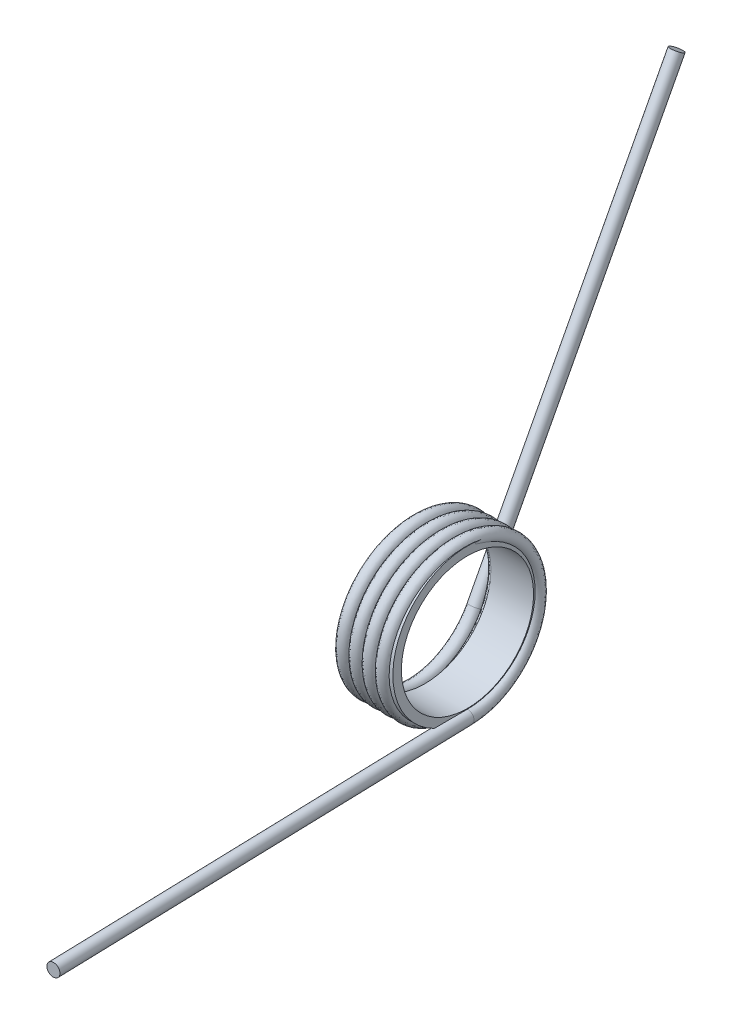
from build123d import *

# Parameters (mm, degrees)
SWEEP1_PITCH        = 0.7874
SKETCH4_R           = 0.381
EXTRUDE1_DEPTH      = 25.4
SKETCH5_R           = 0.381
EXTRUDE2_DEPTH      = 25.4
SKETCH7_R           = 4.445
SKETCH7_R_2         = 3.937
BOSS_EXTRUDE1_DEPTH = 2.54


with BuildPart() as part:
    # Sweep1: the profile of Sketch3 screwed along a left-hand helix of 4.166667 turns, 6 arcs to a turn; built about Z, then put on its axis
    sweep1_z = Axis((0, 0, 0), (0, 0, 1))
    sweep1_corners = [(4.364952965, -0.01095332, -0.380739609), (4.736997132, 0.000254581, 0.008849304), (4.347247035, 0.01095332, 0.380739609), (3.975202868, -0.000254581, -0.008849304)]
    with BuildLine(mode=Mode.PRIVATE) as sweep1_profile:
        ThreePointArc((4.364952965, -0.01095332, -0.380739609), (4.631694937, -0.00756515, -0.262966156), (4.736997132, 0.000254581, 0.008849304))
        ThreePointArc((4.736997132, 0.000254581, 0.008849304), (4.619174953, 0.007925183, 0.275480962), (4.347247035, 0.01095332, 0.380739609))
        ThreePointArc((4.347247035, 0.01095332, 0.380739609), (4.080505063, 0.00756515, 0.262966156), (3.975202868, -0.000254581, -0.008849304))
        ThreePointArc((3.975202868, -0.000254581, -0.008849304), (4.093025047, -0.007925183, -0.275480962), (4.364952965, -0.01095332, -0.380739609))
    sweep1_cap = Face(sweep1_profile.wire())
    sweep1_arcs = [((4.364952965, -0.01095332, -0.380739609), (4.745850097, -0.010698738, -0.371890305), (4.736997132, 0.000254581, 0.008849304), (1, 0.7071067811865476, 1)), ((4.736997132, 0.000254581, 0.008849304), (4.728144167, 0.011207901, 0.389588913), (4.347247035, 0.01095332, 0.380739609), (1, 0.7071067811865476, 1)), ((4.347247035, 0.01095332, 0.380739609), (3.966349903, 0.010698738, 0.371890305), (3.975202868, -0.000254581, -0.008849304), (1, 0.7071067811865476, 1)), ((3.975202868, -0.000254581, -0.008849304), (3.984055833, -0.011207901, -0.389588913), (4.364952965, -0.01095332, -0.380739609), (1, 0.7071067811865476, 1))]  # start, shoulder, end, weights
    sweep1_turn_angles = [0, -30, -60, -90, -120, -150, -180, -210, -240, -270, -300, -330, -360]
    sweep1_turn_weights = [1, 0.8660254037844387, 1, 0.8660254037844387, 1, 0.8660254037844387, 1, 0.8660254037844387, 1, 0.8660254037844387, 1, 0.8660254037844387, 1]
    sweep1_turn_sides = [Face.make_bezier_surface([[Vector(p[j][0], p[j][1], 0).rotate(sweep1_z, sweep1_turn_angles[2 * i + k]) / sweep1_turn_weights[2 * i + k] + Vector(0, 0, p[j][2] + -SWEEP1_PITCH * sweep1_turn_angles[2 * i + k] / 360) for k in range(3)] for j in range(3)], [[p[3][j] * sweep1_turn_weights[2 * i + k] for k in range(3)] for j in range(3)]) for p in sweep1_arcs for i in range(6)]
    sweep1_last_angles = [-1440, -1470, -1500]
    sweep1_last_weights = [1, 0.8660254037844208, 1]
    sweep1_last_sides = [Face.make_bezier_surface([[Vector(p[j][0], p[j][1], 0).rotate(sweep1_z, sweep1_last_angles[2 * i + k]) / sweep1_last_weights[2 * i + k] + Vector(0, 0, p[j][2] + -SWEEP1_PITCH * sweep1_last_angles[2 * i + k] / 360) for k in range(3)] for j in range(3)], [[p[3][j] * sweep1_last_weights[2 * i + k] for k in range(3)] for j in range(3)]) for p in sweep1_arcs for i in range(1)]
    sweep1 = Plane(origin=(0, 0, 0), x_dir=(0, -1, 0), z_dir=(-1, 0, 0)) * Solid(Shell([*[p.moved(Location((0, 0, SWEEP1_PITCH * i))) for i in range(4) for p in sweep1_turn_sides], *sweep1_last_sides, sweep1_cap, sweep1_cap.rotate(sweep1_z, -1500).moved(Location((0, 0, -SWEEP1_PITCH * -1500 / 360)))]))
    add(sweep1)

    # Sketch4 → Extrude1 (add)
    with BuildSketch(Plane(origin=(0, 0, 0), x_dir=(-0.9993165588321744, 0.023236129092747946, 0.028748870388358348), z_dir=(0.028756634544423593, -1.0606099332122199e-14, 0.999586442469924))):
        with Locations(Location((-0.101218902, 4.354923873, 0), (0, 0, 1.33145196))):
            Circle(SKETCH4_R)
    extrude(amount=EXTRUDE1_DEPTH)

    # Sketch5 → Extrude2 (add)
    with BuildSketch(Plane(origin=(-0.002713066, 0.081672005, -0.047153354), x_dir=(0.9995864419308154, 0.02492039753313022, -0.014349874385632802), z_dir=(-0.028756634544423593, 0.8656672524575096, -0.499793221234887))):
        with Locations(Location((-3.279619586, 4.35599229, 0), (0, 0, 180.001881766))):
            Circle(SKETCH5_R)
    extrude(amount=EXTRUDE2_DEPTH)

    # Sketch7 → Boss-Extrude1 (add)
    with BuildSketch(Plane(origin=(0, 0, 0), x_dir=(0, 0, -1), z_dir=(1, 0, 0))):
        Circle(SKETCH7_R)
        Circle(SKETCH7_R_2, mode=Mode.SUBTRACT)
    extrude(amount=-BOSS_EXTRUDE1_DEPTH)


solid = part.part
